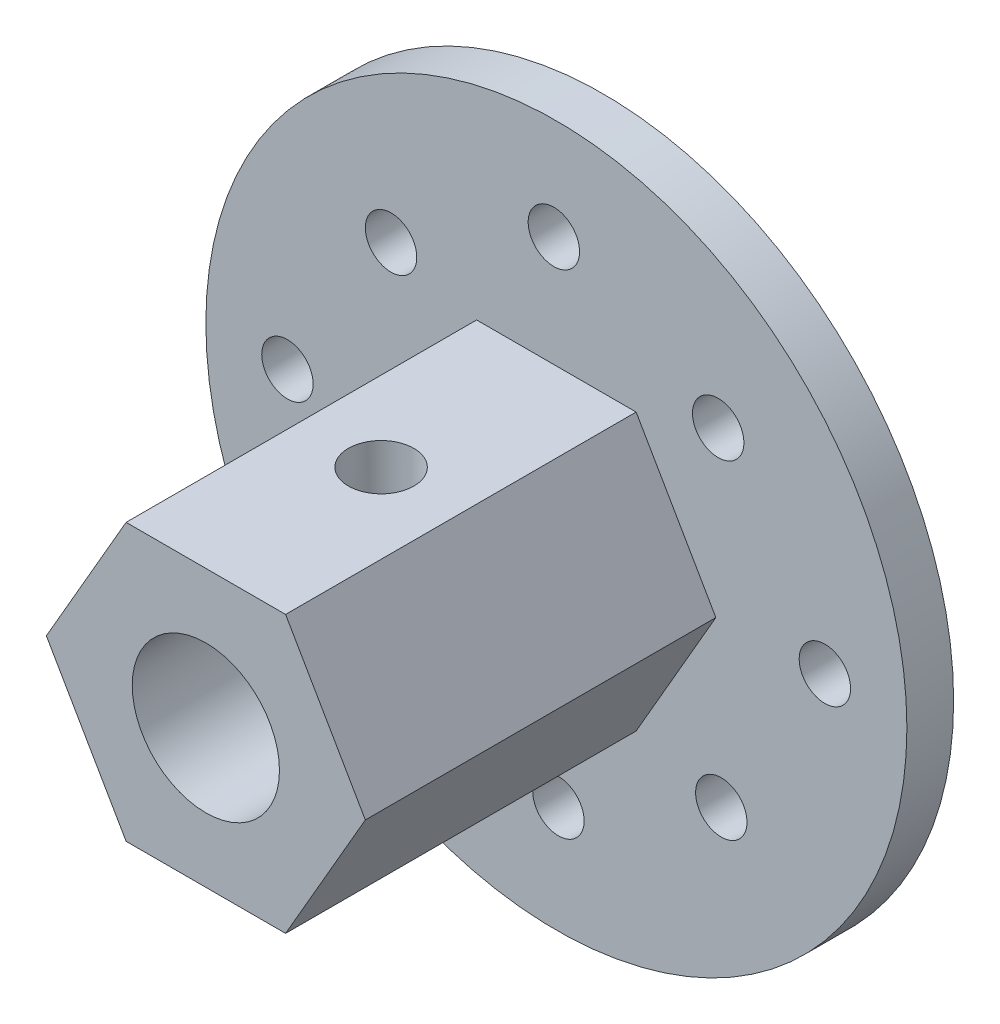
from build123d import *
from build123d.topology import SkipClean

# Parameters (mm, degrees)
SKETCH_1_R          = 3.15
EXTRUDE_1_DEPTH     = 15
EXTRUDE_START       = 2
SKETCH_2_R          = 15
SKETCH_2_R_2        = 3.15
SKETCH_2_R_3        = 1.1
EXTRUDE_2_DEPTH     = 2
SKETCH_3_R          = 1.4
CUT_EXTRUDE_1_DEPTH = 30.786812018


with BuildPart() as part:
    # 草图1 → 凸台-拉伸1 (new body)
    with BuildSketch(Plane.XY):
        Polygon((3.4125, -5.910623381), (6.825, 0), (3.4125, 5.910623381), (-3.4125, 5.910623381), (-6.825, 0), (-3.4125, -5.910623381), align=None)
        Circle(SKETCH_1_R, mode=Mode.SUBTRACT)
    extrude(amount=EXTRUDE_1_DEPTH)

    # 草图2 → 凸台-拉伸2 (add)
    with SkipClean():  # the faces are left unmerged after this step: merging them gives an invalid solid
        with BuildSketch(Plane(origin=(0, 0, 0), x_dir=(-1, 0, 0), z_dir=(0, 0, -1)).offset(EXTRUDE_START)):
            Circle(SKETCH_2_R)
            Circle(SKETCH_2_R_2, mode=Mode.SUBTRACT)
            with Locations((0.107841154, 10.641777672)):
                Circle(SKETCH_2_R_3, mode=Mode.SUBTRACT)
            with Locations((7.074701484, 6.949367968)):
                Circle(SKETCH_2_R_3, mode=Mode.SUBTRACT)
            with Locations((11.509282596, 0.034851677)):
                Circle(SKETCH_2_R_3, mode=Mode.SUBTRACT)
            with Locations((6.942357889, -7.050434427)):
                Circle(SKETCH_2_R_3, mode=Mode.SUBTRACT)
            with Locations((-0.08801923, -10.357308944)):
                Circle(SKETCH_2_R_3, mode=Mode.SUBTRACT)
            with Locations((-7.057604111, -6.919535443)):
                Circle(SKETCH_2_R_3, mode=Mode.SUBTRACT)
            with Locations((-11.489717031, 0.24936543)):
                Circle(SKETCH_2_R_3, mode=Mode.SUBTRACT)
            with Locations((-6.924524538, 7.077286558)):
                Circle(SKETCH_2_R_3, mode=Mode.SUBTRACT)
        extrude(amount=-EXTRUDE_2_DEPTH)

    # 草图3 → 切除-拉伸1 (cut, through all)
    with SkipClean():  # the faces are left unmerged after this step: merging them gives an invalid solid
        with BuildSketch(Plane(origin=(0, 5.910623381, 0), x_dir=(1, 0, 0), z_dir=(0, 1, 0))):
            with Locations((0, -7.5)):
                Circle(SKETCH_3_R)
        extrude(amount=-CUT_EXTRUDE_1_DEPTH, mode=Mode.SUBTRACT)


solid = part.part
